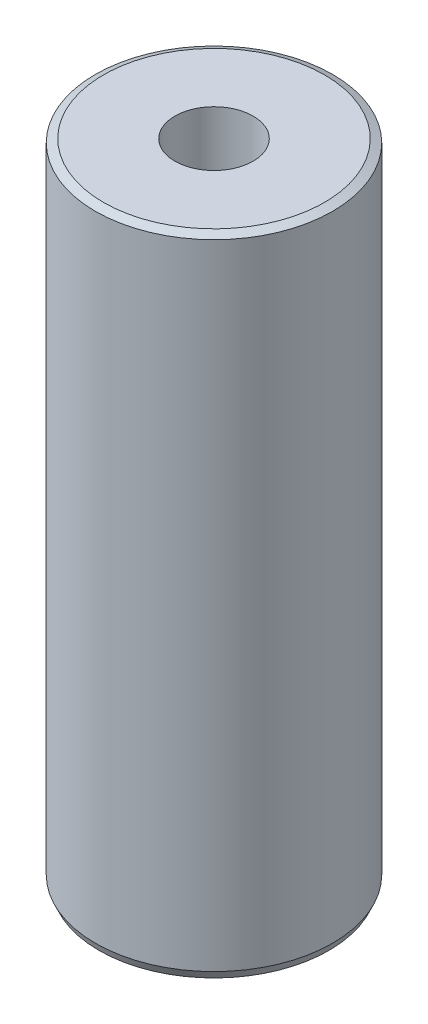
from build123d import *
from OCP.BRepFilletAPI import BRepFilletAPI_MakeChamfer

# Parameters (mm, degrees)
SKETCH1_R           = 60
BOSS_EXTRUDE1_DEPTH = 326.559223291
SKETCH2_R           = 19.787877583
CUT_EXTRUDE1_DEPTH  = 338.403210294
CHAMFER1_SIZE       = 1.850063965
CHAMFER1_SIZE2      = 4.107075598


with BuildPart() as part:
    # Sketch1 → Boss-Extrude1 (new body)
    with BuildSketch(Plane(origin=(0, 0, 0), x_dir=(1, 0, 0), z_dir=(0, 1, 0))):
        Circle(SKETCH1_R)
    extrude(amount=BOSS_EXTRUDE1_DEPTH)

    # Sketch2 → Cut-Extrude1 (cut, through all)
    with BuildSketch(Plane(origin=(0, 0, 0), x_dir=(1, 0, 0), z_dir=(0, 1, 0))):
        Circle(SKETCH2_R)
    extrude(amount=CUT_EXTRUDE1_DEPTH, mode=Mode.SUBTRACT)

    # Chamfer1: one chamfer whose edges measure the first distance from different faces: ONE call of the kernel's chamfer builder (chamfer() names one face for all edges)
    chamfer1_edges_1 = [part.edges().sort_by_distance(p)[0] for p in [
        (-60, 326.559223291, 0),
    ]]
    chamfer1_side_1 = [part.faces().sort_by_distance(p)[0] for p in [
        (-60, 163.279611646, 0),
    ]]
    chamfer1_edges_2 = [part.edges().sort_by_distance(p)[0] for p in [
        (-60, 0, 0),
    ]]
    chamfer1_side_2 = [part.faces().sort_by_distance(p)[0] for p in [
        (-58.302943725, 0, 0),
    ]]
    chamfer1 = BRepFilletAPI_MakeChamfer(part.part.solid().wrapped)
    for e in chamfer1_edges_1:
        chamfer1.Add(CHAMFER1_SIZE, CHAMFER1_SIZE2, e.wrapped, chamfer1_side_1[0].wrapped)  # the first distance lies on this face
    for e in chamfer1_edges_2:
        chamfer1.Add(CHAMFER1_SIZE, CHAMFER1_SIZE2, e.wrapped, chamfer1_side_2[0].wrapped)  # the first distance lies on this face
    add(Compound.cast(chamfer1.Shape()), mode=Mode.REPLACE)


solid = part.part
